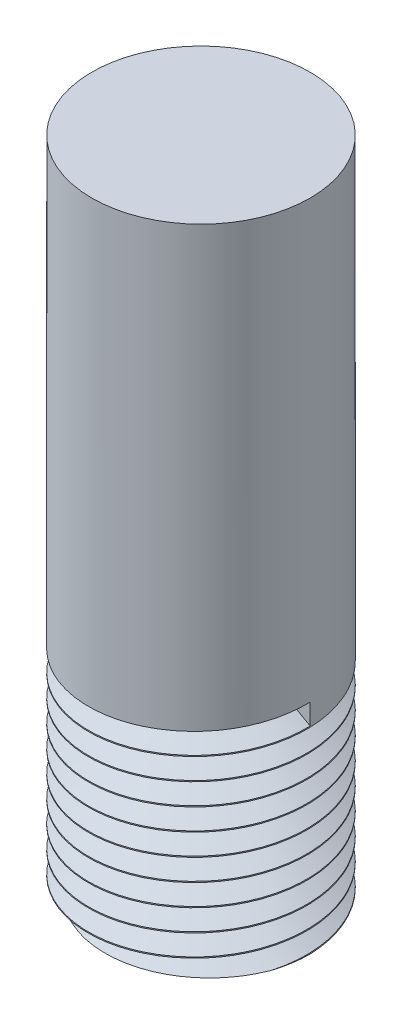
from build123d import *

# Parameters (mm, degrees)
SKETCH1_R           = 5
BOSS_EXTRUDE1_DEPTH = 30
CUT_SWEEP1_PITCH    = 1


with BuildPart() as part:
    # Sketch1 → Boss-Extrude1 (new body)
    with BuildSketch(Plane(origin=(0, 0, 0), x_dir=(1, 0, 0), z_dir=(0, 1, 0))):
        with Locations(Location((0, 0, 0), (0, 0, 270))):
            Circle(SKETCH1_R)
    extrude(amount=BOSS_EXTRUDE1_DEPTH)

    # Cut-Sweep1: the profile of Sketch5 profile screwed along a right-hand helix of 10 turns, 8 arcs to a turn; built about Z, then put on its axis
    cut_sweep1_z = Axis((0, 0, 0), (0, 0, 1))
    cut_sweep1_corners = [(5.0003, 0, 0.000173205), (5.0003, 0, -0.950173205), (4.177275866, 0, -0.475)]
    with BuildLine(mode=Mode.PRIVATE) as cut_sweep1_profile:
        Line(cut_sweep1_corners[0], cut_sweep1_corners[1])
        Line(cut_sweep1_corners[1], cut_sweep1_corners[2])
        Line(cut_sweep1_corners[2], cut_sweep1_corners[0])
    cut_sweep1_cap = Face(cut_sweep1_profile.wire())
    cut_sweep1_turn_angles = [0, 22.5, 45, 67.5, 90, 112.5, 135, 157.5, 180, 202.5, 225, 247.5, 270, 292.5, 315, 337.5, 360]
    cut_sweep1_turn_weights = [1, 0.9238795325112867, 1, 0.9238795325112867, 1, 0.9238795325112867, 1, 0.9238795325112867, 1, 0.9238795325112867, 1, 0.9238795325112867, 1, 0.9238795325112867, 1, 0.9238795325112867, 1]
    cut_sweep1_turn_rails = [Edge.make_bspline([Vector(p[0], p[1], 0).rotate(cut_sweep1_z, cut_sweep1_turn_angles[k]) / cut_sweep1_turn_weights[k] + Vector(0, 0, p[2] + CUT_SWEEP1_PITCH * cut_sweep1_turn_angles[k] / 360) for k in range(17)], [0, 0, 0, 1, 1, 2, 2, 3, 3, 4, 4, 5, 5, 6, 6, 7, 7, 8, 8, 8], 2, cut_sweep1_turn_weights) for p in cut_sweep1_corners]
    cut_sweep1_turn_sides = [Face.make_surface_from_curves(cut_sweep1_turn_rails[p[0]], cut_sweep1_turn_rails[p[1]]) for p in [(0, 1), (1, 2), (2, 0)]]
    cut_sweep1 = Plane(origin=(0, 0, 0), x_dir=(1, 0, 0), z_dir=(0, 1, 0)) * Solid(Shell([*[p.moved(Location((0, 0, CUT_SWEEP1_PITCH * i))) for i in range(10) for p in cut_sweep1_turn_sides], cut_sweep1_cap, cut_sweep1_cap.rotate(cut_sweep1_z, 3600).moved(Location((0, 0, CUT_SWEEP1_PITCH * 3600 / 360)))]))
    add(cut_sweep1, mode=Mode.SUBTRACT)


solid = part.part
